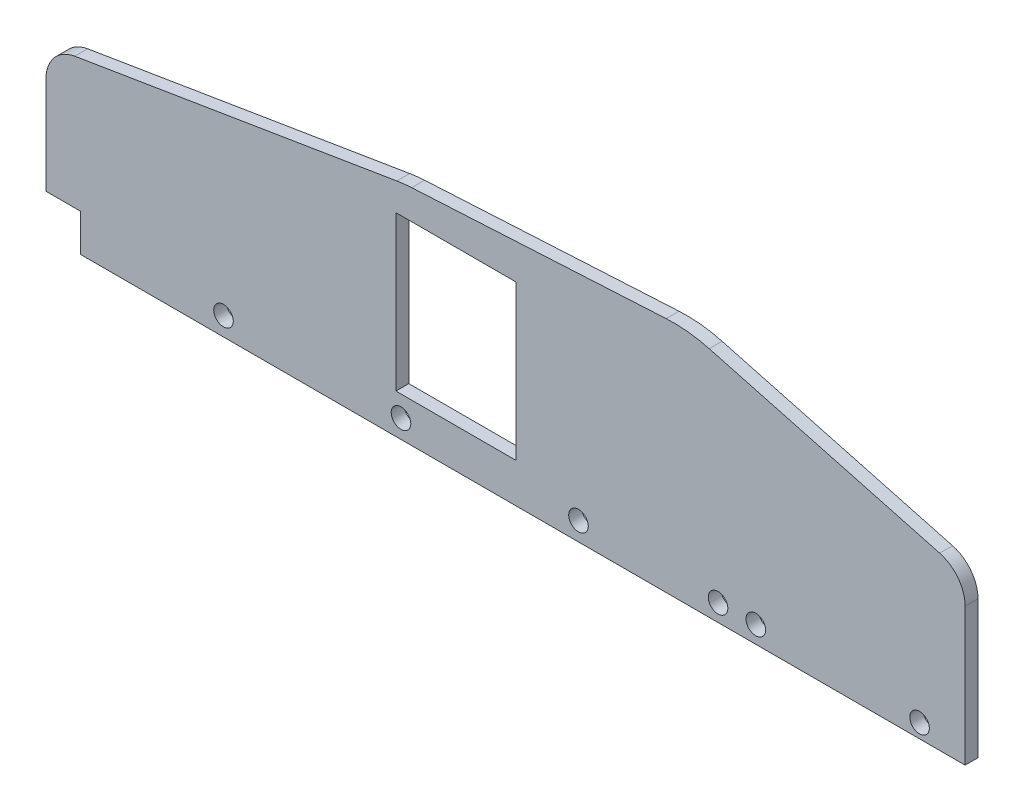
from build123d import *

# Parameters (mm, degrees)
SKETCH2_R           = 7.239
BOSS_EXTRUDE1_DEPTH = 4.7625
FILLET1_R           = 25.4
FILLET2_R           = 101.6
SKETCH3_W           = 25.4
SKETCH3_H           = 27.686
CUT_EXTRUDE1_DEPTH  = 383.819793068
SKETCH5_W           = 88.9
SKETCH5_H           = 114.3
CUT_EXTRUDE2_DEPTH  = 383.819793068


with BuildPart() as part:
    # Sketch2 → Boss-Extrude1 (new, symmetric)
    with BuildSketch(Plane.XY):
        Polygon((-340, 26.400000032), (-340, 121.400000032), (-75, 165), (135, 176.400000032), (340, 121.400000032), (340, 26.400000032), (340, 0), (-340, 0), align=None)
        with Locations((-208.682, 13.700000032)):
            Circle(SKETCH2_R, mode=Mode.SUBTRACT)
        with Locations((-77.364, 13.700000032)):
            Circle(SKETCH2_R, mode=Mode.SUBTRACT)
        with Locations((53.954, 13.700000032)):
            Circle(SKETCH2_R, mode=Mode.SUBTRACT)
        with Locations((185.126699107, 12.7)):
            Circle(SKETCH2_R, mode=Mode.SUBTRACT)
        with Locations((306.284699107, 10.414)):
            Circle(SKETCH2_R, mode=Mode.SUBTRACT)
        with Locations((157.186699107, 12.7)):
            Circle(SKETCH2_R, mode=Mode.SUBTRACT)
    extrude(amount=BOSS_EXTRUDE1_DEPTH, both=True)

    # Fillet1
    fillet1_edges = [part.edges().sort_by_distance(p)[0] for p in [
        (340, 121.400000032, 0),
        (-340, 121.400000032, 0),
    ]]
    fillet(fillet1_edges, radius=FILLET1_R)

    # Fillet2
    fillet2_edges = [part.edges().sort_by_distance(p)[0] for p in [
        (-75, 165, 0),
        (135, 176.400000032, 0),
    ]]
    fillet(fillet2_edges, radius=FILLET2_R)

    # Sketch3 → Cut-Extrude1 (cut, through all)
    with BuildSketch(Plane.XY.offset(4.7625)):
        with Locations((-327.3, 13.843)):
            Rectangle(SKETCH3_W, SKETCH3_H)
    extrude(amount=-CUT_EXTRUDE1_DEPTH, mode=Mode.SUBTRACT)

    # Sketch5 → Cut-Extrude2 (cut, through all)
    with BuildSketch(Plane.XY.offset(4.7625)):
        with Locations((-36.66848567, 86.296499999)):
            Rectangle(SKETCH5_W, SKETCH5_H)
    extrude(amount=-CUT_EXTRUDE2_DEPTH, mode=Mode.SUBTRACT)


solid = part.part
